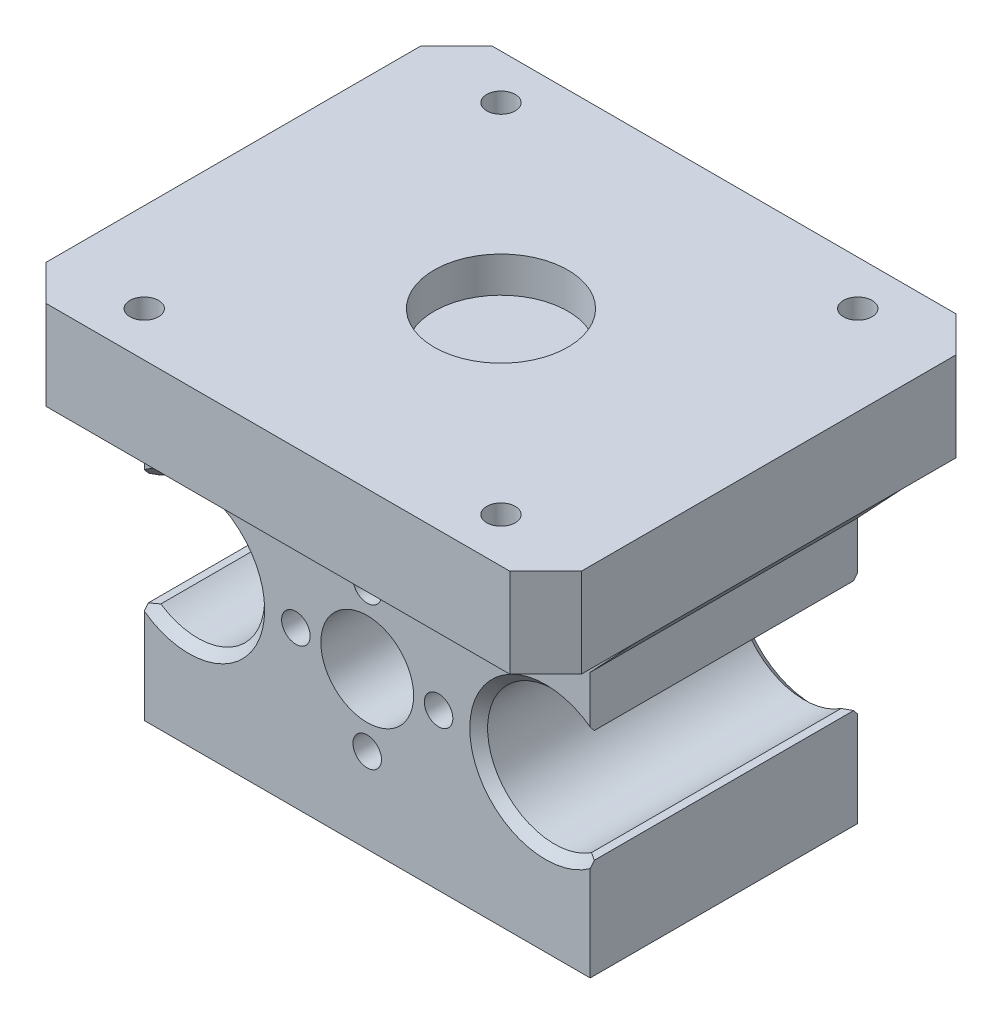
from build123d import *

# Parameters (mm, degrees)
SKETCH_1_W          = 50
SKETCH_1_H          = 35
EXTRUDE_1_DEPTH     = 30
HOLE_WIZARD_360_D   = 8.5
HOLE_WIZARD_465_D   = 3.2
HOLE_WIZARD_619_D   = 15
CHAMFER_1_SIZE      = 1
CHAMFER_1_SIZE_2    = 0.708203932
HOLE_WIZARD_1_D     = 10.4
HOLE_WIZARD_1_DEPTH = 11
SKETCH_11_W         = 60
SKETCH_11_H         = 50
EXTRUDE_3_DEPTH     = 10
HOLE_WIZARD_2_D     = 3.2
CHAMFER_2_SIZE      = 4
HOLE_WIZARD_3_D     = 15
HOLE_WIZARD_3_DEPTH = 4
EXTRUDE_4_DEPTH     = 15
RIB_22_REACH        = 49.762
SKETCH_19_WALL_W    = 104.820665624
SKETCH_19_WALL_H    = 30


with BuildPart() as part:
    # 草图1 → 凸台-拉伸1 (new body)
    with BuildSketch(Plane.XY):
        Rectangle(SKETCH_1_W, SKETCH_1_H)
    extrude(amount=EXTRUDE_1_DEPTH)

    # Hole Wizard 360 (through all)
    with Locations(Plane.XY.offset(30)):
        with Locations((0, 0)):
            Hole(HOLE_WIZARD_360_D / 2)

    # Hole Wizard 465 (through all)
    with Locations(Plane.XY.offset(30)):
        with Locations((8, 0), (0, 8), (-8, 0), (0, -8)):
            Hole(HOLE_WIZARD_465_D / 2)

    # Hole Wizard 619 (through all)
    with Locations(Plane.XY.offset(30)):
        with Locations((20, 0), (-20, 0)):
            Hole(HOLE_WIZARD_619_D / 2)

    # 倒角1
    # the kernel refuses this chamfer: 1, 0.708203932 mm, written as the material it takes off along each edge
    with BuildSketch(Plane(origin=(-20, 0, 0), x_dir=(-0.8790200859122482, 0.4767847402789059, 0), z_dir=(-0.4767847402789059, -0.8790200859122482, 0))) as chamfer_1_piece_1:
        Polygon((7.5, -CHAMFER_1_SIZE), (7.5 + CHAMFER_1_SIZE, 0), (7.5, 0), align=None)
    revolve(axis=Axis((-20, 0, 0), (0, 0, -1)), revolution_arc=303.048763938, mode=Mode.SUBTRACT)
    with BuildSketch(Plane(origin=(-20, 0, 30), x_dir=(-0.879020085912248, 0.47678474027890627, 0), z_dir=(-0.47678474027890627, -0.879020085912248, 0))) as chamfer_1_piece_2:
        Polygon((7.5 + CHAMFER_1_SIZE, 0), (7.5, CHAMFER_1_SIZE), (7.5, 0), align=None)
    revolve(axis=Axis((-20, 0, 30), (0, 0, -1)), revolution_arc=303.048763938, mode=Mode.SUBTRACT)
    with BuildSketch(Plane(origin=(20, 0, 30), x_dir=(0.879020085912248, -0.4767847402789061, 0), z_dir=(0.4767847402789061, 0.879020085912248, 0))) as chamfer_1_piece_3:
        Polygon((7.5 + CHAMFER_1_SIZE, 0), (7.5, CHAMFER_1_SIZE), (7.5, 0), align=None)
    revolve(axis=Axis((20, 0, 30), (0, 0, -1)), revolution_arc=303.048763938, mode=Mode.SUBTRACT)
    with BuildSketch(Plane(origin=(20, 0, 0), x_dir=(0.8790200859122481, 0.476784740278906, 0), z_dir=(0.476784740278906, -0.8790200859122481, 0))) as chamfer_1_piece_4:
        Polygon((7.5, CHAMFER_1_SIZE), (7.5 + CHAMFER_1_SIZE, 0), (7.5, 0), align=None)
    revolve(axis=Axis((20, 0, 0), (0, 0, 1)), revolution_arc=303.048763938, mode=Mode.SUBTRACT)
    with BuildSketch(Plane(origin=(-25, 5.590169944, 32.778051389), x_dir=(0.7914486393779661, 0.611235675682274, 0), z_dir=(0, 0, -1)), Plane(origin=(25, -5.590169944, 32.778051389), x_dir=(-0.7914486393779661, -0.611235675682274, 0), z_dir=(0, 0, -1))) as chamfer_1_piece_5:
        with BuildLine():
            Line((1.080663788, 0), (CHAMFER_1_SIZE_2 * 0.611235676113, -CHAMFER_1_SIZE_2 * 0.791448639936))
            Line((CHAMFER_1_SIZE_2 * 0.611235676113, -CHAMFER_1_SIZE_2 * 0.791448639936), (0, 0))
            ThreePointArc((0, 0), (0.555522087, -0.019473843), (1.080663788, 0))
        make_face()
    extrude(amount=35.556102778, mode=Mode.SUBTRACT)
    with BuildSketch(Plane(origin=(-25, -5.590169944, 32.778051389), x_dir=(0.7914486393779665, -0.6112356756822735, 0), z_dir=(0, 0, -1))) as chamfer_1_piece_6:
        with BuildLine():
            Line((1.080663788, 0), (CHAMFER_1_SIZE_2 * 0.611235676113, CHAMFER_1_SIZE_2 * 0.791448639936))
            Line((CHAMFER_1_SIZE_2 * 0.611235676113, CHAMFER_1_SIZE_2 * 0.791448639936), (0, 0))
            ThreePointArc((0, 0), (0.555522087, 0.019473843), (1.080663788, 0))
        make_face()
    extrude(amount=35.556102778, mode=Mode.SUBTRACT)
    with BuildSketch(Plane(origin=(25, 5.590169944, 32.778051389), x_dir=(0, 1, 0), z_dir=(0, 0, -1))) as chamfer_1_piece_7:
        with BuildLine():
            Line((CHAMFER_1_SIZE_2, 0), (0.660540261, -0.855289885))
            ThreePointArc((0.660540261, -0.855289885), (0.354967464, -0.427764092), (0, 0))
            Line((0, 0), (CHAMFER_1_SIZE_2, 0))
        make_face()
    extrude(amount=35.556102778, mode=Mode.SUBTRACT)

    # 孔1
    with Locations(Plane.XY.offset(30)):
        with Locations((0, 0)):
            Hole(HOLE_WIZARD_1_D / 2, depth=HOLE_WIZARD_1_DEPTH)

    # 草图11 → 凸台-拉伸3 (add)
    with BuildSketch(Plane(origin=(0, 17.5, 0), x_dir=(1, 0, 0), z_dir=(0, 1, 0))):
        with Locations((0, -15)):
            Rectangle(SKETCH_11_W, SKETCH_11_H)
    extrude(amount=EXTRUDE_3_DEPTH)

    # 孔2 (through all)
    with Locations(Plane(origin=(0, 27.5, 0), x_dir=(1, 0, 0), z_dir=(0, 1, 0))):
        with Locations((-20, 5), (20, 5), (20, -35), (-20, -35)):
            Hole(HOLE_WIZARD_2_D / 2)

    # 倒角2
    chamfer_2_edges = [part.edges().sort_by_distance(p)[0] for p in [
        (30, 22.5, 40),
        (30, 22.5, -10),
        (-30, 22.5, -10),
        (-30, 22.5, 40),
    ]]
    chamfer(chamfer_2_edges, length=CHAMFER_2_SIZE)

    # 孔3
    with Locations(Plane(origin=(0, 27.5, 0), x_dir=(1, 0, 0), z_dir=(0, 1, 0))):
        with Locations((0, -15)):
            Hole(HOLE_WIZARD_3_D / 2, depth=HOLE_WIZARD_3_DEPTH)

    # 草图16 → 凸台-拉伸4 (add, symmetric)
    with BuildSketch(Plane(origin=(0, 0, 0), x_dir=(0, 0, -1), z_dir=(1, 0, 0))):
        Polygon((-40, 17.5), (-30, 12.5), (-30, 17.5), align=None)
        Polygon((10, 17.5), (0, 17.5), (0, 12.5), align=None)
    extrude(amount=EXTRUDE_4_DEPTH, both=True)

    # 草图19 wall → 筋22 (add, up to next)
    with BuildSketch(Plane(origin=(-27.5, 14.843465885, 15), x_dir=(0.685325827281, -0.728236575888, 0), z_dir=(0.728236575888, 0.685325827281, 0)), mode=Mode.PRIVATE) as rib_22_sk1:
        Rectangle(SKETCH_19_WALL_W, SKETCH_19_WALL_H)
    rib_22_tool1 = extrude(rib_22_sk1.sketch, amount=RIB_22_REACH, mode=Mode.PRIVATE) - part.part
    rib_22 = rib_22_tool1.solids().sort_by_distance((-27.5, 14.843465885, 15))[0]
    add(rib_22)

    # 镜向1: 筋22 across plane
    add(rib_22.mirror(Plane(origin=(0, 0, 0), x_dir=(0, 0, 1), z_dir=(1, 0, 0))))


solid = part.part
